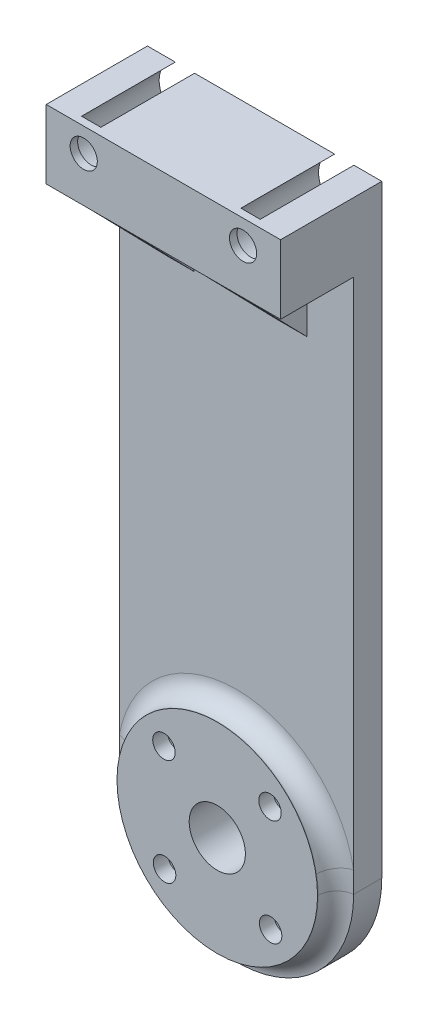
from build123d import *

# Parameters (mm, degrees)
ESBO_O1_R                                            = 10.7
RESSALTO_EXTRUS_O1_DEPTH                             = 2.05
RESSALTO_EXTRUS_O2_DEPTH                             = 3
ESBO_O4_W                                            = 25
ESBO_O4_H                                            = 7.35
RESSALTO_EXTRUS_O3_DEPTH                             = 10.8
REBAIXO_PARA_SHCS_M2_51_D                            = 2.9
REBAIXO_PARA_SHCS_M2_51_CBORE_D                      = 5.5
REBAIXO_PARA_SHCS_M2_51_CBORE_DEPTH                  = 10
REBAIXO_PARA_PARAFUSO_COM_CABE_A_REDONDA_D           = 2.4
REBAIXO_PARA_PARAFUSO_COM_CABE_A_REDONDA_CBORE_D     = 4.4
REBAIXO_PARA_PARAFUSO_COM_CABE_A_REDONDA_CBORE_DEPTH = 3.5
PADR_OCIRCULAR1_COUNT                                = 4
NERVURA1_REACH                                       = 67.842
ESBO_O5_WALL_W                                       = 144.857085312
ESBO_O5_WALL_H                                       = 15
CORTE_EXTRUS_O1_REACH                                = 68.053
ESBO_O6_W                                            = 8.93885445
ESBO_O6_H                                            = 8
CORTE_EXTRUS_O2_REACH                                = 68.474
ESBO_O7_R                                            = 3
FILETE1_R                                            = 2


with BuildPart() as part:
    # Esboço1 → Ressalto-extrusão1 (new body)
    with BuildSketch(Plane(origin=(0, 0, 0), x_dir=(-1, 0, 0), z_dir=(0, 0, -1))):
        Circle(ESBO_O1_R)
    extrude(amount=RESSALTO_EXTRUS_O1_DEPTH)

    # Esboço2 → Ressalto-extrusão2 (add)
    with BuildSketch(Plane(origin=(0, 0, -2.05), x_dir=(-1, 0, 0), z_dir=(0, 0, -1))):
        with BuildLine():
            Line((-12.5, 64.388275999), (12.5, 64.388275999))
            Line((12.5, 64.388275999), (12.5, 0))
            ThreePointArc((12.5, 0), (0, -12.5), (-12.5, 0))
            Line((-12.5, 0), (-12.5, 64.388275999))
        make_face()
    extrude(amount=RESSALTO_EXTRUS_O2_DEPTH)

    # Esboço4 → Ressalto-extrusão3 (add)
    with BuildSketch(Plane(origin=(0, 0, -5.05), x_dir=(-1, 0, 0), z_dir=(0, 0, -1))):
        with Locations((0, 60.713275999)):
            Rectangle(ESBO_O4_W, ESBO_O4_H)
    extrude(amount=-RESSALTO_EXTRUS_O3_DEPTH)

    # Rebaixo para SHCS M2.51 (through all)
    with Locations(Plane(origin=(0, 0, -5.05), x_dir=(-1, 0, 0), z_dir=(0, 0, -1))):
        with Locations((-8.5, 61.838275999), (8.5, 61.838275999)):
            CounterBoreHole(REBAIXO_PARA_SHCS_M2_51_D / 2, REBAIXO_PARA_SHCS_M2_51_CBORE_D / 2, REBAIXO_PARA_SHCS_M2_51_CBORE_DEPTH)

    # Rebaixo para parafuso com cabeça redonda de M21 (through all)
    with Locations(Plane(origin=(0, 0, -5.05), x_dir=(-1, 0, 0), z_dir=(0, 0, -1))):
        with Locations((-5.624741587, 5.688785642)):
            rebaixo_para_parafuso_com_cabe_a_redonda = CounterBoreHole(REBAIXO_PARA_PARAFUSO_COM_CABE_A_REDONDA_D / 2, REBAIXO_PARA_PARAFUSO_COM_CABE_A_REDONDA_CBORE_D / 2, REBAIXO_PARA_PARAFUSO_COM_CABE_A_REDONDA_CBORE_DEPTH)

    # PadrãoCircular1: Rebaixo para parafuso com cabeça redonda de M21 ×4 about axis
    padr_ocircular1_axis = Axis((0, 0, 0), (0, 0, 1))
    for i in range(1, PADR_OCIRCULAR1_COUNT):
        add(rebaixo_para_parafuso_com_cabe_a_redonda.rotate(padr_ocircular1_axis, i * 360 / PADR_OCIRCULAR1_COUNT), mode=Mode.SUBTRACT)

    # Esboço5 wall → Nervura1 (add, up to next)
    with BuildSketch(Plane(origin=(0, 53.038275999, 1.85), x_dir=(0, -0.71600013962, -0.69810013613), z_dir=(0, 0.69810013613, -0.71600013962)), mode=Mode.PRIVATE) as nervura1_sk1:
        Rectangle(ESBO_O5_WALL_W, ESBO_O5_WALL_H)
    nervura1_tool1 = extrude(nervura1_sk1.sketch, amount=NERVURA1_REACH, mode=Mode.PRIVATE) - part.part
    add(nervura1_tool1.solids().sort_by_distance((0, 53.038275999, 1.85))[0])

    # Esboço6 → Corte-extrusão1 (cut, up to next)
    with BuildSketch(Plane.XY.offset(-2.05), mode=Mode.PRIVATE) as corte_extrus_o1_sk1:
        with Locations((-0.067802218, 53.038275999)):
            Rectangle(ESBO_O6_W, ESBO_O6_H)
    corte_extrus_o1_tool1 = extrude(corte_extrus_o1_sk1.sketch, amount=CORTE_EXTRUS_O1_REACH, mode=Mode.PRIVATE) & part.part
    add(corte_extrus_o1_tool1.solids().sort_by_distance((-0.067802, 53.038276, -2.05))[0], mode=Mode.SUBTRACT)

    # Esboço7 → Corte-extrusão2 (cut, up to next)
    with BuildSketch(Plane(origin=(0, 0, -5.05), x_dir=(-1, 0, 0), z_dir=(0, 0, -1)), mode=Mode.PRIVATE) as corte_extrus_o2_sk1:
        Circle(ESBO_O7_R)
    corte_extrus_o2_tool1 = extrude(corte_extrus_o2_sk1.sketch, amount=-CORTE_EXTRUS_O2_REACH, mode=Mode.PRIVATE) & part.part
    add(corte_extrus_o2_tool1.solids().sort_by_distance((0, 0, -5.05))[0], mode=Mode.SUBTRACT)

    # Filete1
    filete1_edges = [part.edges().sort_by_distance(p)[0] for p in [
        (10.7, 0, -2.05),
    ]]
    fillet(filete1_edges, radius=FILETE1_R - 0.0001)  # a hair under: the kernel refuses the full size


solid = part.part
